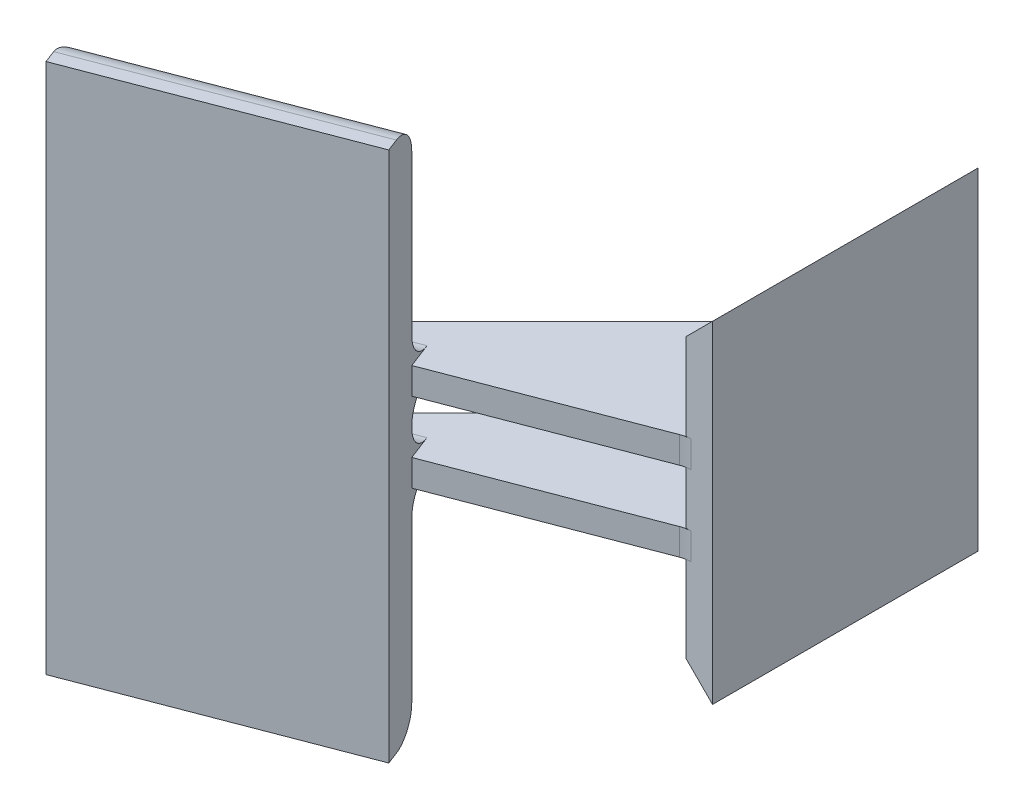
from build123d import *

# Parameters (mm, degrees)
SKETCH1_W           = 25
SKETCH1_H           = 20
BOSS_EXTRUDE1_DEPTH = 2
BOSS_EXTRUDE2_DEPTH = 4
CUT_EXTRUDE1_DEPTH  = 2
SKETCH5_W           = 20
SKETCH5_H           = 40
BOSS_EXTRUDE5_DEPTH = 3
FILLET3_R           = 2
CHAMFER1_SIZE       = 2
FILLET4_R           = 2


with BuildPart() as part:
    # Sketch1 → Boss-Extrude1 (new body)
    with BuildSketch(Plane.YZ):
        Rectangle(SKETCH1_W, SKETCH1_H)
    extrude(amount=BOSS_EXTRUDE1_DEPTH)

    # Sketch2 → Boss-Extrude2 (add, symmetric)
    with BuildSketch(Plane(origin=(0, 0, 0), x_dir=(-1, 0, 0), z_dir=(0, 1, 0))):
        Polygon((0, -5), (24.285410332, 19.285410332), (0, 10), align=None)
    extrude(amount=BOSS_EXTRUDE2_DEPTH, both=True)

    # Sketch2<2> → Cut-Extrude1 (cut, symmetric)
    with BuildSketch(Plane(origin=(0, 0, 0), x_dir=(-1, 0, 0), z_dir=(0, 1, 0))):
        Polygon((0, -5), (24.285410332, 19.285410332), (0, 10), align=None)
    extrude(amount=CUT_EXTRUDE1_DEPTH, both=True, mode=Mode.SUBTRACT)

    # Sketch5 → Boss-Extrude5 (add)
    with BuildSketch(Plane(origin=(3.335798817, 0, 8.724573298), x_dir=(0.9340542435228668, 0, -0.3571311665997872), z_dir=(0.3571311665997872, 0, 0.9340542435228668))):
        with Locations((-29.571311666, 0)):
            Rectangle(SKETCH5_W, SKETCH5_H)
    extrude(amount=BOSS_EXTRUDE5_DEPTH)

    # Fillet3
    fillet3_edges = [part.edges().sort_by_distance(p)[0] for p in [
        (-19.615139114, -4, 17.499754499),
        (-24.285410332, 3, 19.285410332),
        (-19.615139114, 4, 17.499754499),
        (-24.285410332, -3, 19.285410332),
        (-19.615139114, -2, 17.499754499),
        (-19.615139114, 2, 17.499754499),
        (-33.625952767, 0, 22.856721998),
        (-24.285410332, -20, 19.285410332),
        (-24.285410332, 20, 19.285410332),
    ]]
    fillet(fillet3_edges, radius=FILLET3_R - 0.0001)  # a hair under: the kernel refuses the full size

    # Chamfer1
    chamfer1_edges = [part.edges().sort_by_distance(p)[0] for p in [
        (0, -12.5, 0),
        (0, 0, -10),
        (0, 12.5, 0),
    ]]
    chamfer(chamfer1_edges, length=CHAMFER1_SIZE - 0.0001)  # a hair under: the kernel refuses the full size

    # Fillet4
    fillet4_edges = [part.edges().sort_by_distance(p)[0] for p in [
        (0, 3, 10),
        (0, -3, 10),
    ]]
    fillet(fillet4_edges, radius=FILLET4_R)


solid = part.part
